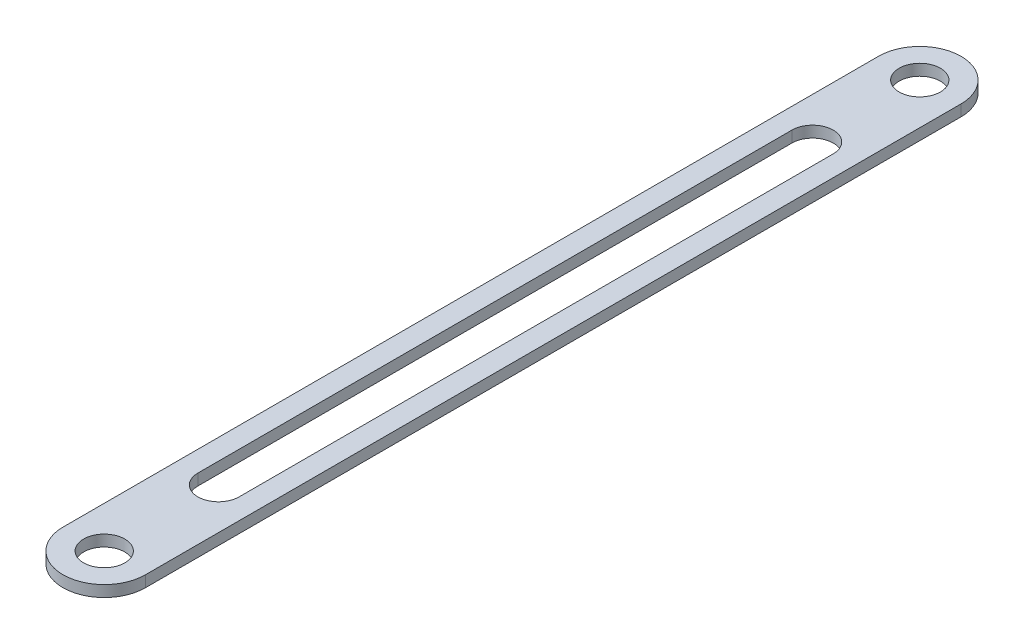
from build123d import *

# Parameters (mm, degrees)
SKETCH1_R           = 5.5
BOSS_EXTRUDE1_DEPTH = 3


with BuildPart() as part:
    # Sketch1 → Boss-Extrude1 (new body)
    with BuildSketch(Plane(origin=(0, 0, 0), x_dir=(1, 0, 0), z_dir=(0, 1, 0))):
        with BuildLine():
            Line((-11, 23.045356371), (-11, -194.404643629))
            ThreePointArc((-11, -194.404643629), (0, -205.404643629), (11, -194.404643629))
            Line((11, -194.404643629), (11, 23.045356371))
            ThreePointArc((11, 23.045356371), (0, 34.045356371), (-11, 23.045356371))
        make_face()
        with Locations((0, 23.045356371)):
            Circle(SKETCH1_R, mode=Mode.SUBTRACT)
        with Locations((0, -194.404643629)):
            Circle(SKETCH1_R, mode=Mode.SUBTRACT)
        with BuildLine():
            Line((-5.5, -5.534643629), (-5.5, -163.934643629))
            ThreePointArc((-5.5, -163.934643629), (0, -169.434643629), (5.5, -163.934643629))
            Line((5.5, -163.934643629), (5.5, -5.534643629))
            ThreePointArc((5.5, -5.534643629), (0, -0.034643629), (-5.5, -5.534643629))
        make_face(mode=Mode.SUBTRACT)
    extrude(amount=BOSS_EXTRUDE1_DEPTH)


solid = part.part
